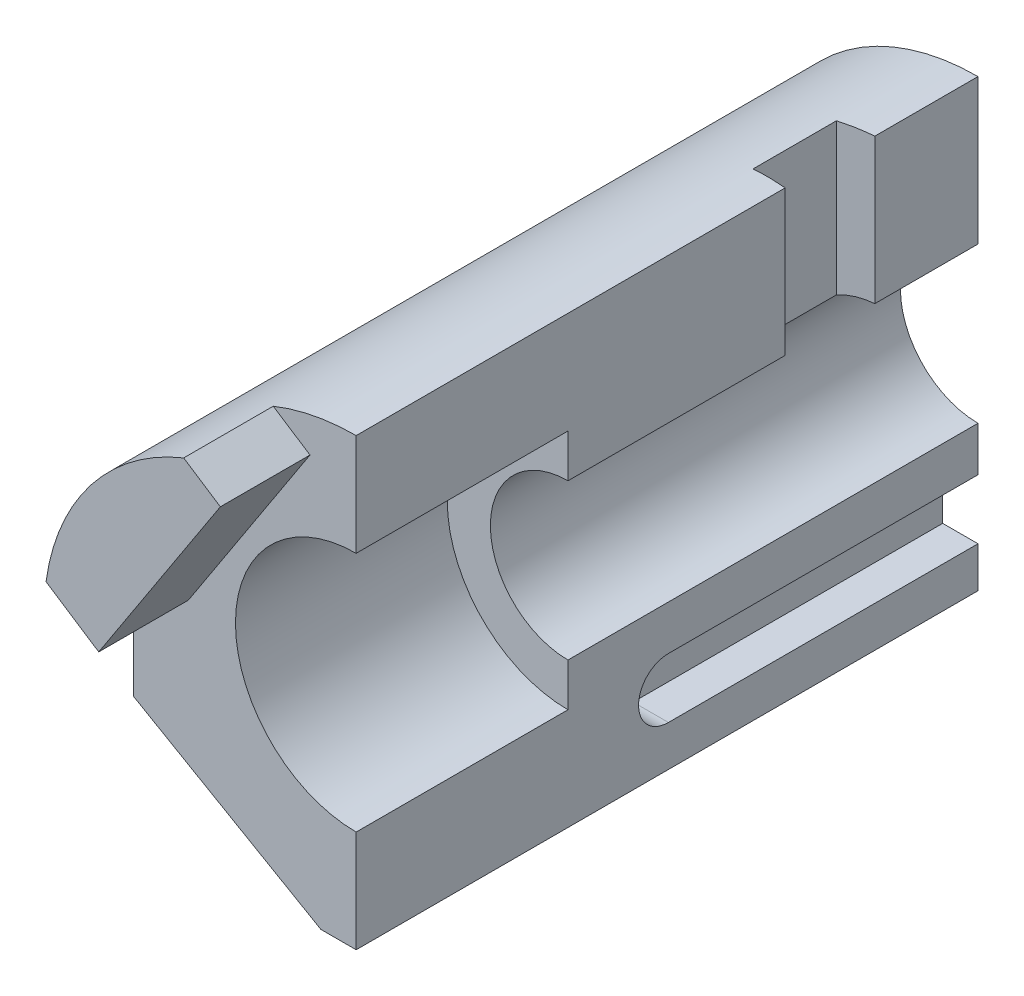
from build123d import *

# Parameters (mm, degrees)
BOSS_EXTRUDE4_DEPTH = 229
CUT_EXTRUDE2_DEPTH  = 78
BOSS_EXTRUDE5_START = 33
BOSS_EXTRUDE5_DEPTH = 33
CUT_EXTRUDE3_DEPTH  = 13
SKETCH5_W           = 33
SKETCH5_H           = 80
CUT_EXTRUDE6_DEPTH  = 13
CUT_EXTRUDE6_DRAFT  = -5


with BuildPart() as part:
    # Sketch2 → Boss-Extrude4 (new body)
    with BuildSketch(Plane.XY):
        with BuildLine():
            Line((0, 0), (-13, 0))
            Line((-13, 0), (-82, 39.837168574))
            Line((-82, 39.837168574), (-82, 82))
            ThreePointArc((-82, 82), (-57.982756057, 139.982756057), (0, 164))
            Line((0, 164), (0, 110.575))
            ThreePointArc((0, 110.575), (-28.575, 82), (0, 53.425))
            Line((0, 53.425), (0, 0))
        make_face()
    extrude(amount=-BOSS_EXTRUDE4_DEPTH)

    # Sketch2<13> → Cut-Extrude2 (cut)
    with BuildSketch(Plane.XY):
        with BuildLine():
            ThreePointArc((0, 126.45), (-44.45, 82), (0, 37.55))
            Line((0, 37.55), (0, 53.425))
            ThreePointArc((0, 53.425), (-28.575, 82), (0, 110.575))
            Line((0, 110.575), (0, 126.45))
        make_face()
    extrude(amount=-CUT_EXTRUDE2_DEPTH, mode=Mode.SUBTRACT)

    # Sketch2<14> → Boss-Extrude5 (add)
    with BuildSketch(Plane.XY.offset(BOSS_EXTRUDE5_START)):
        with BuildLine():
            ThreePointArc((-70.072223839, 124.589710568), (-77.250649767, 109.501583782), (-81.221618507, 93.271587604))
            Line((-81.221618507, 93.271587604), (-61.794148195, 80.60400062))
            Line((-61.794148195, 80.60400062), (-17.006397602, 149.292117473))
            Line((-17.006397602, 149.292117473), (-30.524818085, 158.106737421))
            ThreePointArc((-30.524818085, 158.106737421), (-53.016874514, 144.555663347), (-70.072223839, 124.589710568))
        make_face()
    extrude(amount=-BOSS_EXTRUDE5_DEPTH)

    # Sketch4 → Cut-Extrude3 (cut)
    with BuildSketch(Plane(origin=(0, 0, 0), x_dir=(0, 0, -1), z_dir=(1, 0, 0))):
        with BuildLine():
            Line((229, 15), (115, 15))
            ThreePointArc((115, 15), (104, 26), (115, 37))
            Line((115, 37), (229, 37))
            ThreePointArc((229, 37), (240, 26), (229, 15))
        make_face()
    extrude(amount=-CUT_EXTRUDE3_DEPTH, mode=Mode.SUBTRACT)


with BuildPart() as cut_extrude6_tool:
    # Sketch5 → Cut-Extrude6 (with draft: the straight prism first)
    with BuildSketch(Plane(origin=(0, 0, 0), x_dir=(0, 0, -1), z_dir=(1, 0, 0))):
        with Locations((174.5, 143.47178065)):
            Rectangle(SKETCH5_W, SKETCH5_H)
    extrude(amount=-CUT_EXTRUDE6_DEPTH)
    # Cut-Extrude6: the draft: its side faces are tilted about the plane it starts from
    cut_extrude6_sides = [cut_extrude6_tool.faces().sort_by_distance(p)[0] for p in [
        (-6.5, 143.47178065, -158),
        (-6.5, 103.47178065, -174.5),
        (-6.5, 143.47178065, -191),
        (-6.5, 183.47178065, -174.5),
    ]]
    draft(cut_extrude6_sides, Plane(origin=(0, 0, 0), x_dir=(0, 0, -1), z_dir=(1, 0, 0)), CUT_EXTRUDE6_DRAFT)


with BuildPart() as part_1:
    add(part.part)

    # Cut-Extrude6: cut by cut_extrude6_tool
    add(cut_extrude6_tool.part, mode=Mode.SUBTRACT)


solid = part_1.part
